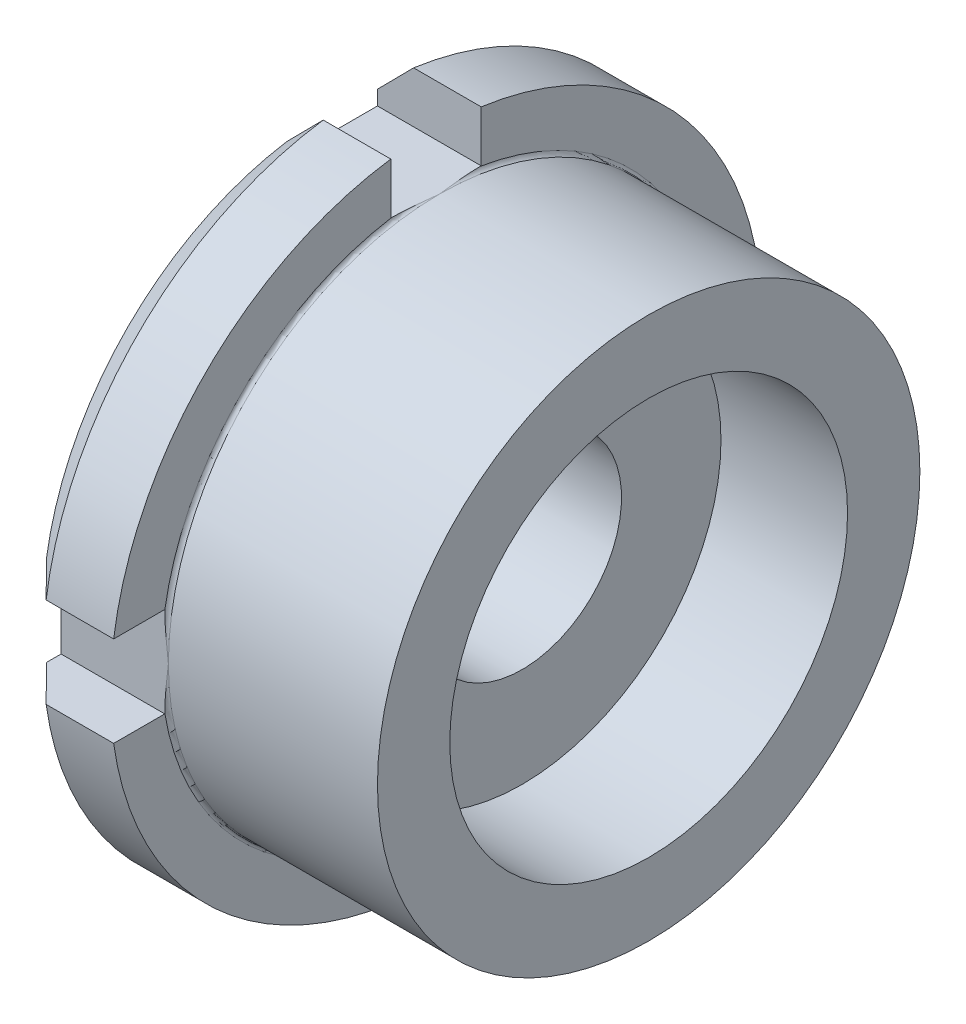
from build123d import *

# Parameters (mm, degrees)
SKETCH2_W          = 5
SKETCH2_H          = 3
CUT_EXTRUDE1_DEPTH = 31.890937182
CIRPATTERN3_COUNT  = 4
SCALE1_SCALE       = 0.317565217


with BuildPart() as part:
    # Sketch1 → Revolve3 (revolve)
    with BuildSketch(Plane.XY):
        with BuildLine():
            Line((5.5, 5.5), (10.5, 5.5))
            Line((10.5, 5.5), (10.5, 11))
            Line((10.5, 11), (17.5, 11))
            Line((17.5, 11), (17.5, 15))
            Line((17.5, 15), (5.935714286, 15))
            ThreePointArc((5.935714286, 15), (5.794292929, 15.058578644), (5.735714286, 15.2))
            Line((5.735714286, 15.2), (5.735714286, 18))
            Line((5.735714286, 18), (2, 18))
            Line((2, 18), (0, 16))
            Line((0, 16), (0, 12))
            ThreePointArc((0, 12), (0.292893219, 11.292893219), (1, 11))
            Line((1, 11), (4.5, 11))
            ThreePointArc((4.5, 11), (5.207106781, 10.707106781), (5.5, 10))
            Line((5.5, 10), (5.5, 5.5))
        make_face()
    revolve(axis=Axis((0, 0, 0), (1, 0, 0)))

    # Sketch2 → Cut-Extrude1 (cut, symmetric)
    with BuildSketch(Plane.ZY):
        with Locations((0, 16.5)):
            Rectangle(SKETCH2_W, SKETCH2_H)
    cut_extrude1 = extrude(amount=CUT_EXTRUDE1_DEPTH, both=True, mode=Mode.SUBTRACT)

    # CirPattern3: Cut-Extrude1 ×4 about axis
    cirpattern3_axis = Axis((0, 0, 0), (-1, 0, 0))
    for i in range(1, CIRPATTERN3_COUNT):
        add(cut_extrude1.rotate(cirpattern3_axis, i * 360 / CIRPATTERN3_COUNT), mode=Mode.SUBTRACT)


with BuildPart() as part_1:
    # Scale1: scaled about (7.791140763, 0, 0)
    add(part.part.scale(SCALE1_SCALE).moved(Location((5.316945453, 0, 0))))


solid = part_1.part
